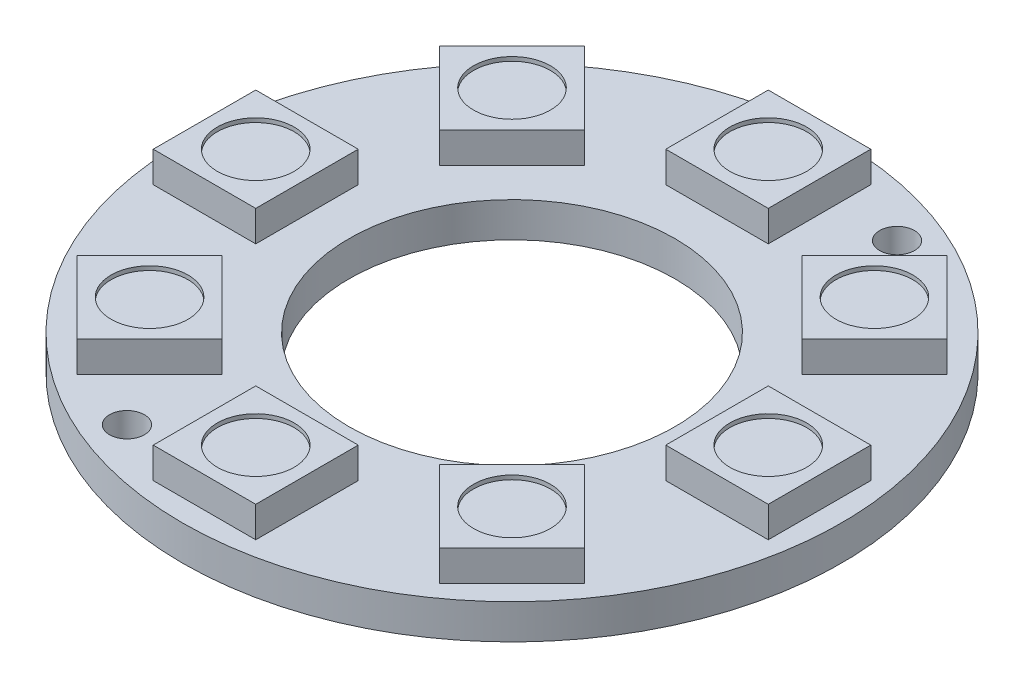
from build123d import *

# Parameters (mm, degrees)
ESQUISSE1_R                  = 16.075
ESQUISSE1_R_2                = 7.95
ESQUISSE1_R_3                = 0.85
BOSS_EXTRU_1_DEPTH           = 1.7
ESQUISSE3_W                  = 3
ESQUISSE3_H                  = 2
BOSS_EXTRU_2_DEPTH           = 0.1
ESQUISSE4_W                  = 5
ESQUISSE4_H                  = 5
BOSS_EXTRU_3_DEPTH           = 1.5
ESQUISSE5_R                  = 1.875
ENL_V_MAT_EXTRU_1_DEPTH      = 0.2
R_P_TITION_CIRCULAIRE1_COUNT = 8
ESQUISSE6_W                  = 0.108706013
ESQUISSE6_H                  = 1.211295573
BOSS_EXTRU_4_DEPTH           = 0.1


with BuildPart() as part:
    # Esquisse1 → Boss.-Extru.1 (new body)
    with BuildSketch(Plane(origin=(0, 0, 0), x_dir=(1, 0, 0), z_dir=(0, 1, 0))):
        Circle(ESQUISSE1_R)
        Circle(ESQUISSE1_R_2, mode=Mode.SUBTRACT)
        with Locations((5.50107434, 13.28076828)):
            Circle(ESQUISSE1_R_3, mode=Mode.SUBTRACT)
        with Locations((-5.50107434, -13.28076828)):
            Circle(ESQUISSE1_R_3, mode=Mode.SUBTRACT)
    extrude(amount=BOSS_EXTRU_1_DEPTH)

    # Esquisse3 → Boss.-Extru.2 (add)
    with BuildSketch(Plane.XZ):
        with Locations((-11.95, -4.5)):
            Rectangle(ESQUISSE3_W, ESQUISSE3_H)
        with Locations((-11.95, -1.5)):
            Rectangle(ESQUISSE3_W, ESQUISSE3_H)
        with Locations((-11.95, 1.5)):
            Rectangle(ESQUISSE3_W, ESQUISSE3_H)
        with Locations((-11.95, 4.5)):
            Rectangle(ESQUISSE3_W, ESQUISSE3_H)
    extrude(amount=BOSS_EXTRU_2_DEPTH)

    # Esquisse4 → Boss.-Extru.3 (add)
    with BuildSketch(Plane(origin=(0, 1.7, 0), x_dir=(1, 0, 0), z_dir=(0, 1, 0))):
        with Locations((0, 12.5)):
            Rectangle(ESQUISSE4_W, ESQUISSE4_H)
    boss_extru_3 = extrude(amount=BOSS_EXTRU_3_DEPTH)

    # Esquisse5 → Enlèv. mat.-Extru.1 (cut)
    with BuildSketch(Plane(origin=(0, 3.2, 0), x_dir=(1, 0, 0), z_dir=(0, 1, 0))):
        with Locations((0, 12.5)):
            Circle(ESQUISSE5_R)
    enl_v_mat_extru_1 = extrude(amount=-ENL_V_MAT_EXTRU_1_DEPTH, mode=Mode.SUBTRACT)

    # Répétition circulaire1: Boss.-Extru.3, Enlèv. mat.-Extru.1 ×8 about axis
    r_p_tition_circulaire1_axis = Axis((0, 1.7, 0), (0, -1, 0))
    add([boss_extru_3.rotate(r_p_tition_circulaire1_axis, i * 360 / R_P_TITION_CIRCULAIRE1_COUNT) for i in range(1, R_P_TITION_CIRCULAIRE1_COUNT)])
    add([enl_v_mat_extru_1.rotate(r_p_tition_circulaire1_axis, i * 360 / R_P_TITION_CIRCULAIRE1_COUNT) for i in range(1, R_P_TITION_CIRCULAIRE1_COUNT)], mode=Mode.SUBTRACT)

    # Esquisse6 → Boss.-Extru.4 (add)
    # profile 1 of 9: a face of its own
    with BuildSketch(Plane.XZ):
        with BuildLine():
            Line((-15.094705696, -5.1), (-15.094705696, -3.888704427))
            Line((-15.094705696, -3.888704427), (-14.850117167, -3.888704427))
            add(Edge.make_bspline(
                [(-14.850117167, -3.888704427), (-14.828843706, -3.888857594), (-14.78774349, -3.889153511), (-14.72835109, -3.89102977), (-14.673398499, -3.894348881), (-14.623066449, -3.899183517), (-14.577216761, -3.905119915), (-14.53597782, -3.912560871), (-14.499136389, -3.921347322), (-14.476478433, -3.928838475), (-14.465763764, -3.93238095)],
                knots=[0, 0, 0, 0, 1.314313732, 2.53924729, 3.670748893, 4.714932338, 5.66265055, 6.526160246, 7.303039223, 8, 8, 8, 8], degree=3))
            add(Edge.make_bspline(
                [(-14.465763764, -3.93238095), (-14.451749164, -3.937721277), (-14.42403777, -3.948280831), (-14.384581677, -3.968200172), (-14.347438038, -3.990769412), (-14.312407666, -4.016018302), (-14.280290743, -4.044661756), (-14.249832579, -4.075483028), (-14.222279161, -4.10960292), (-14.197046733, -4.146313824), (-14.174296644, -4.185183278), (-14.15452167, -4.226137219), (-14.138098581, -4.268967664), (-14.124465198, -4.313555506), (-14.113720502, -4.359998785), (-14.106389764, -4.408351582), (-14.101554622, -4.458422799), (-14.101068702, -4.492399454), (-14.100822149, -4.509638997)],
                knots=[0, 0, 0, 0, 0.984719456, 1.947108742, 2.898477687, 3.838006223, 4.779231079, 5.722358779, 6.681677486, 7.655904652, 8.64651281, 9.637519902, 10.640069247, 11.656948941, 12.698408672, 13.768548281, 14.867775369, 16, 16, 16, 16], degree=3))
            add(Edge.make_bspline(
                [(-14.100822149, -4.509638997), (-14.101039825, -4.524611039), (-14.101468778, -4.554115011), (-14.105320461, -4.597597371), (-14.110918834, -4.639789762), (-14.119586241, -4.680491266), (-14.130108078, -4.720058485), (-14.143592965, -4.758069716), (-14.159040616, -4.794873655), (-14.17705427, -4.829972666), (-14.196830014, -4.863225627), (-14.218052516, -4.894572409), (-14.240699139, -4.923565711), (-14.264985834, -4.950293332), (-14.290598754, -4.974714982), (-14.317705587, -4.997034665), (-14.346376278, -5.01681566), (-14.376482415, -5.034835277), (-14.408902266, -5.050554555), (-14.444249901, -5.063854584), (-14.482676066, -5.074876202), (-14.524086439, -5.084071976), (-14.568552573, -5.091366503), (-14.616118062, -5.096255428), (-14.666709825, -5.099561549), (-14.701449528, -5.099851012), (-14.719330245, -5.1)],
                knots=[0, 0, 0, 0, 1.105936401, 2.179363191, 3.223086493, 4.248585256, 5.251745608, 6.245858792, 7.225916811, 8.198733463, 9.158002045, 10.082870192, 10.993790845, 11.873723703, 12.748670949, 13.606408763, 14.465103618, 15.319838547, 16.196477973, 17.123216899, 18.106603292, 19.147568657, 20.255746949, 21.433717677, 22.679120308, 24, 24, 24, 24], degree=3))
            Line((-14.719330245, -5.1), (-15.094705696, -5.1))
        make_face()
        with BuildLine():
            Line((-14.985999683, -4.975764557), (-14.846962751, -4.975764557))
            add(Edge.make_bspline(
                [(-14.846962751, -4.975764557), (-14.82698386, -4.975678694), (-14.788557135, -4.97551355), (-14.733301985, -4.974064424), (-14.682815394, -4.971696536), (-14.637090194, -4.96838275), (-14.596152202, -4.963998339), (-14.559915863, -4.95910993), (-14.528499957, -4.953019726), (-14.509489734, -4.947499347), (-14.500704982, -4.944948343)],
                knots=[0, 0, 0, 0, 1.375205317, 2.645023457, 3.804390687, 4.853969522, 5.800190428, 6.637939096, 7.370582563, 8, 8, 8, 8], degree=3))
            add(Edge.make_bspline(
                [(-14.500704982, -4.944948343), (-14.489648151, -4.941054354), (-14.46779858, -4.933359383), (-14.43634605, -4.919323007), (-14.407012969, -4.902696394), (-14.379288135, -4.884214697), (-14.353564835, -4.863226059), (-14.329538228, -4.840186875), (-14.307256688, -4.814979892), (-14.286950422, -4.787636396), (-14.268778115, -4.758326575), (-14.253041229, -4.727338577), (-14.239249234, -4.695011932), (-14.2284242, -4.660850227), (-14.219939737, -4.625158864), (-14.213930089, -4.587935331), (-14.210187281, -4.54918658), (-14.209750713, -4.522831514), (-14.209528162, -4.509396349)],
                knots=[0, 0, 0, 0, 0.998632004, 1.973411704, 2.929992603, 3.868527914, 4.809262121, 5.754881198, 6.702106254, 7.672490631, 8.653608572, 9.636854334, 10.631411391, 11.644891563, 12.686317036, 13.754757253, 14.855430412, 16, 16, 16, 16], degree=3))
            add(Edge.make_bspline(
                [(-14.209528162, -4.509396349), (-14.209705803, -4.495229908), (-14.210054779, -4.46739981), (-14.214441161, -4.426565065), (-14.220851183, -4.387291176), (-14.230120601, -4.349575518), (-14.241932767, -4.313344507), (-14.25667411, -4.278798527), (-14.27351687, -4.245572734), (-14.293556315, -4.214434006), (-14.315503466, -4.184984604), (-14.339860155, -4.15800562), (-14.366239417, -4.133435596), (-14.394353536, -4.110891893), (-14.424994849, -4.091281476), (-14.457441543, -4.073739604), (-14.49216962, -4.058852473), (-14.516330708, -4.050934454), (-14.528609427, -4.0469105)],
                knots=[0, 0, 0, 0, 1.122418816, 2.205001699, 3.251619955, 4.274784885, 5.280384055, 6.268708349, 7.249350384, 8.229342522, 9.199999885, 10.157847722, 11.105861043, 12.055065948, 13.010012805, 13.98527497, 14.976112212, 16, 16, 16, 16], degree=3))
            add(Edge.make_bspline(
                [(-14.528609427, -4.0469105), (-14.538767403, -4.04410153), (-14.560366045, -4.03812889), (-14.5956111, -4.031613722), (-14.635277621, -4.025867163), (-14.679541719, -4.021001894), (-14.728352936, -4.017510829), (-14.781748814, -4.014890515), (-14.83975243, -4.013123188), (-14.879961399, -4.013002506), (-14.900830463, -4.01293987)],
                knots=[0, 0, 0, 0, 0.674548936, 1.434276114, 2.292660221, 3.240891867, 4.284742987, 5.42552168, 6.663806718, 8, 8, 8, 8], degree=3))
            Line((-14.900830463, -4.01293987), (-14.985999683, -4.01293987))
            Line((-14.985999683, -4.01293987), (-14.985999683, -4.975764557))
        make_face(mode=Mode.SUBTRACT)
    # profile 2 of 9: a face of its own
    with BuildSketch(Plane.XZ):
        with Locations((-13.797998256, -4.494352214)):
            Rectangle(ESQUISSE6_W, ESQUISSE6_H)
    # profile 3 of 9: a face of its own
    with BuildSketch(Plane.XZ):
        Polygon((-14.413354701, -1.041666667), (-14.31159188, -1.041666667), (-13.958814103, -1.875697783), (-13.606036325, -1.041666667), (-13.504273504, -1.041666667), (-13.952029915, -2.1), (-13.965598291, -2.1), align=None)
    # profile 4 of 9: a face of its own
    with BuildSketch(Plane.XZ):
        with BuildLine():
            Line((-14.576175214, -1.041666667), (-14.576175214, -1.150213675))
            Line((-14.576175214, -1.150213675), (-14.936161191, -1.150213675))
            Line((-14.936161191, -1.150213675), (-14.993190772, -1.42857739))
            add(Edge.make_bspline(
                [(-14.993190772, -1.42857739), (-14.981985781, -1.425483951), (-14.960277884, -1.419490902), (-14.928237641, -1.412836776), (-14.897820474, -1.408825558), (-14.878082446, -1.408277852), (-14.868531317, -1.408012821)],
                knots=[0, 0, 0, 0, 1.100273476, 2.13160584, 3.095893838, 4, 4, 4, 4], degree=3))
            add(Edge.make_bspline(
                [(-14.868531317, -1.408012821), (-14.856713138, -1.408268615), (-14.833475647, -1.408771572), (-14.799476251, -1.413601155), (-14.767020828, -1.421202986), (-14.736177255, -1.431822763), (-14.706888469, -1.445402611), (-14.679423944, -1.462366164), (-14.653371433, -1.482182195), (-14.629198315, -1.504965092), (-14.607268346, -1.530039009), (-14.587986725, -1.556998651), (-14.571608989, -1.585582016), (-14.558437047, -1.6160622), (-14.547918927, -1.64810223), (-14.540918204, -1.682039225), (-14.536256485, -1.717553299), (-14.535735668, -1.741835872), (-14.535470085, -1.754218416)],
                knots=[0, 0, 0, 0, 1.052922333, 2.070308379, 3.05430497, 4.020497103, 4.973039431, 5.925935799, 6.892292201, 7.88610001, 8.88166317, 9.857072816, 10.836096531, 11.812156883, 12.81219415, 13.836441305, 14.89672472, 16, 16, 16, 16], degree=3))
            add(Edge.make_bspline(
                [(-14.535470085, -1.754218416), (-14.535671192, -1.762842992), (-14.536070686, -1.779975591), (-14.538102259, -1.805419194), (-14.542013773, -1.830324146), (-14.547265442, -1.854693751), (-14.55408184, -1.87848187), (-14.56233353, -1.901756594), (-14.572431853, -1.924373059), (-14.583508483, -1.946545261), (-14.595980632, -1.967771953), (-14.609823181, -1.987622956), (-14.624447984, -2.00639606), (-14.640184308, -2.023889927), (-14.657178418, -2.039989601), (-14.675224503, -2.054790629), (-14.694178564, -2.068543317), (-14.714333839, -2.080689414), (-14.735241209, -2.091866308), (-14.757202599, -2.101035568), (-14.779718096, -2.109233276), (-14.803111761, -2.115767585), (-14.827330604, -2.120887667), (-14.852414548, -2.12436523), (-14.878232036, -2.126898105), (-14.895732338, -2.127056661), (-14.904572316, -2.127136752)],
                knots=[0, 0, 0, 0, 1.056347294, 2.098418968, 3.122841568, 4.141288669, 5.149314143, 6.15115421, 7.162517403, 8.180376062, 9.185164535, 10.17417709, 11.141909838, 12.097768115, 13.052685741, 14.0056014, 14.954263652, 15.917497458, 16.885230207, 17.854509472, 18.828990115, 19.81800267, 20.826176721, 21.857883937, 22.917946725, 24, 24, 24, 24], degree=3))
            add(Edge.make_bspline(
                [(-14.904572316, -2.127136752), (-14.915117604, -2.126927856), (-14.935864212, -2.126516877), (-14.966259717, -2.122217478), (-14.995504371, -2.116059818), (-15.023362759, -2.106795993), (-15.050084546, -2.095188406), (-15.075309987, -2.08051804), (-15.099683638, -2.063893407), (-15.122214659, -2.044274824), (-15.14312615, -2.022831272), (-15.161845499, -1.999560747), (-15.178516843, -1.974847321), (-15.192873209, -1.948570974), (-15.205119039, -1.920800752), (-15.214739286, -1.891432606), (-15.222503931, -1.860619986), (-15.225788823, -1.839406901), (-15.227457265, -1.828632479)],
                knots=[0, 0, 0, 0, 1.0467383, 2.05933395, 3.04377827, 4.011590433, 4.970194871, 5.932262533, 6.905835911, 7.896367577, 8.894135286, 9.877477877, 10.858688626, 11.851381753, 12.8477658, 13.868841284, 14.917554742, 16, 16, 16, 16], degree=3))
            Line((-15.227457265, -1.828632479), (-15.132478632, -1.828632479))
            add(Edge.make_bspline(
                [(-15.132478632, -1.828632479), (-15.130141664, -1.838724882), (-15.125649881, -1.858123042), (-15.115790523, -1.885377043), (-15.103735842, -1.909664046), (-15.08940167, -1.931305325), (-15.072302018, -1.950176617), (-15.052789548, -1.966994157), (-15.030912974, -1.982166161), (-15.006603593, -1.994812569), (-14.980957733, -2.00559812), (-14.95411622, -2.01278018), (-14.926809905, -2.017830212), (-14.90834097, -2.018335721), (-14.899060163, -2.018589744)],
                knots=[0, 0, 0, 0, 1.136247022, 2.183929868, 3.172523383, 4.106158343, 5.02341133, 5.958108904, 6.928429099, 7.938127109, 8.96079061, 9.975095812, 10.982467395, 12, 12, 12, 12], degree=3))
            add(Edge.make_bspline(
                [(-14.899060163, -2.018589744), (-14.8900013, -2.018341556), (-14.872164325, -2.017852873), (-14.845914215, -2.014091552), (-14.820570798, -2.008298668), (-14.796384145, -1.99962945), (-14.772931013, -1.98909307), (-14.750804658, -1.975572083), (-14.729364979, -1.960011554), (-14.709278377, -1.942184192), (-14.690881686, -1.922538594), (-14.674626859, -1.901529953), (-14.661087173, -1.879118431), (-14.649677097, -1.855692025), (-14.641012886, -1.830993985), (-14.634831922, -1.805140058), (-14.631202426, -1.778066386), (-14.630703141, -1.75960019), (-14.630448718, -1.750190304)],
                knots=[0, 0, 0, 0, 1.027316725, 2.022795036, 3.002884548, 3.971462791, 4.93288096, 5.914575861, 6.907176829, 7.935150275, 8.956128384, 9.956726525, 10.942570165, 11.921478529, 12.907843606, 13.90538589, 14.932640048, 16, 16, 16, 16], degree=3))
            add(Edge.make_bspline(
                [(-14.630448718, -1.750190304), (-14.63064783, -1.741700732), (-14.631037562, -1.725083602), (-14.634221806, -1.700772413), (-14.63976051, -1.677769374), (-14.647448207, -1.655963403), (-14.657208915, -1.635333934), (-14.669136729, -1.615859675), (-14.683455494, -1.597797302), (-14.699811851, -1.581138363), (-14.717730354, -1.565763841), (-14.737519295, -1.552657415), (-14.758764559, -1.541631421), (-14.781210176, -1.532116098), (-14.805390038, -1.525282063), (-14.830825305, -1.520151297), (-14.857790643, -1.517183319), (-14.876227018, -1.51677151), (-14.885703793, -1.516559829)],
                knots=[0, 0, 0, 0, 1.045622112, 2.046656509, 3.013763289, 3.955457236, 4.890082067, 5.820317437, 6.762574623, 7.722996705, 8.69280354, 9.665887285, 10.63943826, 11.638615906, 12.663482002, 13.728887084, 14.832589034, 16, 16, 16, 16], degree=3))
            add(Edge.make_bspline(
                [(-14.885703793, -1.516559829), (-14.893907064, -1.516735389), (-14.910844738, -1.517097875), (-14.936826164, -1.51976684), (-14.964128662, -1.524072531), (-14.992647569, -1.529995039), (-15.022468532, -1.537745389), (-15.05352862, -1.547032868), (-15.085893138, -1.558136901), (-15.107700164, -1.566522595), (-15.118910256, -1.570833333)],
                knots=[0, 0, 0, 0, 0.817624296, 1.688186739, 2.600797293, 3.572016777, 4.590301741, 5.671205678, 6.80286297, 8, 8, 8, 8], degree=3))
            Line((-15.118910256, -1.570833333), (-15.010363248, -1.041666667))
            Line((-15.010363248, -1.041666667), (-14.576175214, -1.041666667))
        make_face()
    # profile 5 of 9: a face of its own
    with BuildSketch(Plane.XZ):
        with BuildLine():
            Line((-14.162339744, 0.9), (-14.162339744, 1.69375))
            Line((-14.162339744, 1.69375), (-14.002063301, 1.69375))
            add(Edge.make_bspline(
                [(-14.002063301, 1.69375), (-13.988123013, 1.693649631), (-13.961190448, 1.69345572), (-13.922271197, 1.692226226), (-13.886261308, 1.690051245), (-13.853279213, 1.686883156), (-13.823234367, 1.682993093), (-13.796210897, 1.678117109), (-13.772069071, 1.672359434), (-13.757221538, 1.667450555), (-13.750200321, 1.665129207)],
                knots=[0, 0, 0, 0, 1.314313732, 2.53924729, 3.670748893, 4.714932338, 5.66265055, 6.526160246, 7.303039223, 8, 8, 8, 8], degree=3))
            add(Edge.make_bspline(
                [(-13.750200321, 1.665129207), (-13.741016692, 1.661629743), (-13.72285769, 1.654710172), (-13.697002503, 1.641657225), (-13.672662644, 1.626867825), (-13.649707588, 1.610322478), (-13.628661686, 1.591552706), (-13.608702752, 1.571355831), (-13.59064727, 1.548997404), (-13.57411271, 1.524941112), (-13.559204802, 1.499470343), (-13.546246457, 1.472633631), (-13.535484569, 1.444567264), (-13.526550748, 1.415349293), (-13.519509855, 1.384915472), (-13.514706096, 1.353230363), (-13.511537675, 1.32041919), (-13.511219256, 1.298154624), (-13.511057692, 1.286857722)],
                knots=[0, 0, 0, 0, 0.984719456, 1.947108742, 2.898477687, 3.838006223, 4.779231079, 5.722358779, 6.681677486, 7.655904652, 8.64651281, 9.637519902, 10.640069247, 11.656948941, 12.698408672, 13.768548281, 14.867775369, 16, 16, 16, 16], degree=3))
            add(Edge.make_bspline(
                [(-13.511057692, 1.286857722), (-13.511200333, 1.277046691), (-13.511481422, 1.25771303), (-13.514005392, 1.22921947), (-13.51767395, 1.201571214), (-13.523353616, 1.174899921), (-13.530248472, 1.148971915), (-13.539084985, 1.124063531), (-13.549207678, 1.099946274), (-13.561011847, 1.076946239), (-13.573970696, 1.055155903), (-13.587877592, 1.034614667), (-13.602717699, 1.015615644), (-13.618632531, 0.998101298), (-13.635416423, 0.982098032), (-13.653179263, 0.967472165), (-13.671966883, 0.954509875), (-13.691695136, 0.942701798), (-13.712939544, 0.93240111), (-13.736102499, 0.923685733), (-13.761282785, 0.916463376), (-13.788418593, 0.910437476), (-13.81755681, 0.905657445), (-13.848726004, 0.902453781), (-13.881878286, 0.900287312), (-13.904642869, 0.90009763), (-13.916359926, 0.9)],
                knots=[0, 0, 0, 0, 1.105936401, 2.179363191, 3.223086493, 4.248585256, 5.251745608, 6.245858792, 7.225916811, 8.198733463, 9.158002045, 10.082870192, 10.993790845, 11.873723703, 12.748670949, 13.606408763, 14.465103618, 15.319838547, 16.196477973, 17.123216899, 18.106603292, 19.147568657, 20.255746949, 21.433717677, 22.679120308, 24, 24, 24, 24], degree=3))
            Line((-13.916359926, 0.9), (-14.162339744, 0.9))
        make_face()
        with BuildLine():
            Line((-14.091105769, 0.981410256), (-13.999996244, 0.981410256))
            add(Edge.make_bspline(
                [(-13.999996244, 0.981410256), (-13.986904274, 0.981466521), (-13.961723622, 0.981574739), (-13.925515469, 0.982524337), (-13.892432106, 0.98407599), (-13.862468835, 0.986247481), (-13.835642574, 0.989120542), (-13.811897259, 0.992323868), (-13.791310727, 0.996314719), (-13.778853516, 0.999932168), (-13.773096955, 1.001603816)],
                knots=[0, 0, 0, 0, 1.375205317, 2.645023457, 3.804390687, 4.853969522, 5.800190428, 6.637939096, 7.370582563, 8, 8, 8, 8], degree=3))
            add(Edge.make_bspline(
                [(-13.773096955, 1.001603816), (-13.765851523, 1.004155509), (-13.751533716, 1.009197947), (-13.730923184, 1.018395845), (-13.711701506, 1.0292911), (-13.693533697, 1.041401973), (-13.676677473, 1.05515562), (-13.660933075, 1.070252969), (-13.646332203, 1.086770856), (-13.633025708, 1.104688778), (-13.621117574, 1.123895214), (-13.610805349, 1.144201342), (-13.601767591, 1.165384672), (-13.594674053, 1.187770499), (-13.589114269, 1.211158697), (-13.585176206, 1.235550909), (-13.582723581, 1.260942582), (-13.582437502, 1.278212796), (-13.582291667, 1.287016727)],
                knots=[0, 0, 0, 0, 0.998632004, 1.973411704, 2.929992603, 3.868527914, 4.809262121, 5.754881198, 6.702106254, 7.672490631, 8.653608572, 9.636854334, 10.631411391, 11.644891563, 12.686317036, 13.754757253, 14.855430412, 16, 16, 16, 16], degree=3))
            add(Edge.make_bspline(
                [(-13.582291667, 1.287016727), (-13.582408073, 1.296299855), (-13.582636754, 1.314536644), (-13.585511107, 1.341295248), (-13.589711531, 1.367031038), (-13.595785688, 1.391745736), (-13.603526084, 1.415487559), (-13.61318594, 1.438125198), (-13.624222834, 1.45989773), (-13.637354484, 1.480302631), (-13.651736234, 1.499600533), (-13.667696932, 1.517279594), (-13.684983001, 1.533380087), (-13.703405905, 1.548152753), (-13.723484854, 1.561003265), (-13.744746852, 1.57249828), (-13.767503817, 1.58225367), (-13.783336339, 1.587442269), (-13.791382462, 1.590079127)],
                knots=[0, 0, 0, 0, 1.122418816, 2.205001699, 3.251619955, 4.274784885, 5.280384055, 6.268708349, 7.249350384, 8.229342522, 9.199999885, 10.157847722, 11.105861043, 12.055065948, 13.010012805, 13.98527497, 14.976112212, 16, 16, 16, 16], degree=3))
            add(Edge.make_bspline(
                [(-13.791382462, 1.590079127), (-13.798038883, 1.591919816), (-13.812192259, 1.595833628), (-13.835287995, 1.600102954), (-13.861281073, 1.603868617), (-13.890286899, 1.607056779), (-13.922272406, 1.60934444), (-13.957262196, 1.611061506), (-13.995271392, 1.612219617), (-14.021619931, 1.612298699), (-14.035295222, 1.612339744)],
                knots=[0, 0, 0, 0, 0.674548936, 1.434276114, 2.292660221, 3.240891867, 4.284742987, 5.42552168, 6.663806718, 8, 8, 8, 8], degree=3))
            Line((-14.035295222, 1.612339744), (-14.091105769, 1.612339744))
            Line((-14.091105769, 1.612339744), (-14.091105769, 0.981410256))
        make_face(mode=Mode.SUBTRACT)
    # profile 6 of 9: a face of its own
    with BuildSketch(Plane.XZ):
        Polygon((-14.976442308, 0.9), (-14.976442308, 1.69375), (-14.961495893, 1.69375), (-14.437099359, 1.069021685), (-14.437099359, 1.69375), (-14.365865385, 1.69375), (-14.365865385, 0.9), (-14.382083834, 0.9), (-14.905208333, 1.523297276), (-14.905208333, 0.9), align=None)
    # profile 7 of 9: a face of its own
    with BuildSketch(Plane.XZ):
        with BuildLine():
            Line((-15.190144231, 1.558278245), (-15.251201923, 1.500400641))
            add(Edge.make_bspline(
                [(-15.251201923, 1.500400641), (-15.262250671, 1.510794426), (-15.284084703, 1.53133415), (-15.319681044, 1.557983965), (-15.356820296, 1.580813599), (-15.395308666, 1.599388763), (-15.434193017, 1.614209836), (-15.472957221, 1.624761753), (-15.511203657, 1.631491061), (-15.53664158, 1.63229578), (-15.549176182, 1.632692308)],
                knots=[0, 0, 0, 0, 1.08915593, 2.152340314, 3.188132944, 4.216796309, 5.218260357, 6.173443236, 7.099959455, 8, 8, 8, 8], degree=3))
            add(Edge.make_bspline(
                [(-15.549176182, 1.632692308), (-15.556867551, 1.632598508), (-15.572230342, 1.632411151), (-15.595049962, 1.630019874), (-15.617630253, 1.626580699), (-15.639928589, 1.621604595), (-15.661988328, 1.615297897), (-15.683732744, 1.607409051), (-15.705202401, 1.598211701), (-15.726195066, 1.587583962), (-15.74654693, 1.575909068), (-15.76576857, 1.562971274), (-15.783982502, 1.549185245), (-15.800846384, 1.534205826), (-15.816457221, 1.518168705), (-15.831186584, 1.501372205), (-15.844516435, 1.483357432), (-15.856556752, 1.464455835), (-15.867297691, 1.444999392), (-15.876779296, 1.425175375), (-15.884738814, 1.405049537), (-15.89103653, 1.384596622), (-15.896232339, 1.363974864), (-15.899887582, 1.343041472), (-15.901948321, 1.321774032), (-15.902304778, 1.307532511), (-15.902483974, 1.300373097)],
                knots=[0, 0, 0, 0, 1.02818874, 2.053710826, 3.065248034, 4.081641283, 5.106893873, 6.131558223, 7.173050175, 8.228653731, 9.27666206, 10.308777013, 11.325269123, 12.329503258, 13.32196095, 14.316845687, 15.314881793, 16.315733098, 17.311955233, 18.285320748, 19.252783886, 20.203351036, 21.145449891, 22.095197417, 23.042428769, 24, 24, 24, 24], degree=3))
            add(Edge.make_bspline(
                [(-15.902483974, 1.300373097), (-15.902312588, 1.293054537), (-15.901970284, 1.278437401), (-15.899779462, 1.256621959), (-15.895713593, 1.23513052), (-15.890278059, 1.213892461), (-15.883478838, 1.19287141), (-15.875003251, 1.172158501), (-15.864964445, 1.151754502), (-15.853344727, 1.131843257), (-15.840602499, 1.112447857), (-15.826327908, 1.094178108), (-15.811164882, 1.076790725), (-15.794561016, 1.060671757), (-15.777048727, 1.045390052), (-15.7581048, 1.031366639), (-15.738101742, 1.018331399), (-15.717009035, 1.006448617), (-15.695055547, 0.99583311), (-15.672545533, 0.986393405), (-15.649407082, 0.978619341), (-15.625761794, 0.972283378), (-15.601637855, 0.967089917), (-15.576912814, 0.963748801), (-15.551768468, 0.961324274), (-15.534818814, 0.961147002), (-15.526279547, 0.961057692)],
                knots=[0, 0, 0, 0, 0.93586088, 1.869166235, 2.799637598, 3.729985548, 4.670839027, 5.622275134, 6.589130586, 7.576015415, 8.568469353, 9.55398029, 10.53834874, 11.515998671, 12.510579167, 13.508179873, 14.527009472, 15.561807829, 16.601455013, 17.643573243, 18.680854198, 19.719860599, 20.772568776, 21.833555941, 22.908541556, 24, 24, 24, 24], degree=3))
            add(Edge.make_bspline(
                [(-15.526279547, 0.961057692), (-15.515988386, 0.961272816), (-15.49578002, 0.961695246), (-15.466074166, 0.964983704), (-15.437543827, 0.970119674), (-15.41026917, 0.977641225), (-15.384218517, 0.987235094), (-15.359296368, 0.99880012), (-15.335698938, 1.012779885), (-15.31335529, 1.028558244), (-15.292772857, 1.046137501), (-15.274209511, 1.065106868), (-15.257961337, 1.085374269), (-15.243786164, 1.106820331), (-15.23205938, 1.12962257), (-15.222433961, 1.153669241), (-15.215055875, 1.178971159), (-15.212027157, 1.196454439), (-15.210496795, 1.205288462)],
                knots=[0, 0, 0, 0, 1.13008108, 2.219097802, 3.278683437, 4.311054135, 5.322181354, 6.324827112, 7.324222904, 8.330512327, 9.32562643, 10.293043162, 11.24128371, 12.174520618, 13.111833804, 14.052305215, 15.015860969, 16, 16, 16, 16], degree=3))
            Line((-15.210496795, 1.205288462), (-15.475080128, 1.205288462))
            Line((-15.475080128, 1.205288462), (-15.475080128, 1.286698718))
            Line((-15.475080128, 1.286698718), (-15.139262821, 1.286698718))
            add(Edge.make_bspline(
                [(-15.139262821, 1.286698718), (-15.139649683, 1.271525055), (-15.140406841, 1.241827457), (-15.145717917, 1.198518127), (-15.154294162, 1.157612404), (-15.166009982, 1.119067207), (-15.181176341, 1.08293716), (-15.199630468, 1.04918558), (-15.221667717, 1.018030511), (-15.24650312, 0.989217612), (-15.274375075, 0.963516166), (-15.304530458, 0.940926962), (-15.337019092, 0.921899048), (-15.371810245, 0.906418505), (-15.408790022, 0.894336724), (-15.448043994, 0.88577067), (-15.489518928, 0.880638517), (-15.517943496, 0.879982794), (-15.532480719, 0.879647436)],
                knots=[0, 0, 0, 0, 1.140356446, 2.231883559, 3.274166699, 4.278491846, 5.25512956, 6.21435461, 7.1637429, 8.11826594, 9.068280886, 10.0076534, 10.945064095, 11.891975133, 12.864533718, 13.863980011, 14.907571808, 16, 16, 16, 16], degree=3))
            add(Edge.make_bspline(
                [(-15.532480719, 0.879647436), (-15.541441053, 0.879776504), (-15.55911372, 0.880031069), (-15.585214699, 0.881840218), (-15.610596016, 0.884625277), (-15.635253975, 0.888831046), (-15.659279278, 0.893982405), (-15.682551934, 0.900578857), (-15.705160597, 0.908214437), (-15.727140211, 0.916899349), (-15.748291278, 0.926962207), (-15.768708006, 0.938144929), (-15.788503253, 0.950389852), (-15.807542178, 0.96390874), (-15.825923981, 0.978600476), (-15.843530137, 0.994494508), (-15.860459209, 1.011542244), (-15.871063814, 1.023647841), (-15.876407252, 1.029747596)],
                knots=[0, 0, 0, 0, 1.107784379, 2.184907829, 3.233506516, 4.263428166, 5.276301166, 6.270063455, 7.25232949, 8.225834625, 9.190232166, 10.146266622, 11.1027726, 12.066435141, 13.031522626, 14.010570082, 14.99756817, 16, 16, 16, 16], degree=3))
            add(Edge.make_bspline(
                [(-15.876407252, 1.029747596), (-15.884160133, 1.039424691), (-15.899537205, 1.05861825), (-15.919330644, 1.08937038), (-15.936203819, 1.121211516), (-15.949894379, 1.154230298), (-15.960584623, 1.188395841), (-15.968251399, 1.223664487), (-15.972743409, 1.260081654), (-15.97339055, 1.284725383), (-15.973717949, 1.297193009)],
                knots=[0, 0, 0, 0, 1.023165419, 2.029347347, 3.013907458, 3.994755782, 4.975994455, 5.96558838, 6.970761222, 8, 8, 8, 8], degree=3))
            add(Edge.make_bspline(
                [(-15.973717949, 1.297193009), (-15.973597245, 1.306528927), (-15.973357371, 1.325082109), (-15.970448727, 1.352626891), (-15.966275548, 1.379682584), (-15.960141663, 1.406227071), (-15.952409117, 1.43227808), (-15.942758594, 1.457847708), (-15.93152252, 1.482951043), (-15.918462952, 1.507415295), (-15.903929512, 1.530915831), (-15.888156515, 1.553358048), (-15.870919985, 1.574333246), (-15.852501401, 1.594107066), (-15.832681013, 1.612431091), (-15.8116445, 1.629474969), (-15.789375653, 1.645261565), (-15.765804412, 1.659542224), (-15.741282598, 1.672370045), (-15.715868991, 1.68361617), (-15.689571348, 1.6929106), (-15.662586687, 1.700796797), (-15.634710754, 1.706628623), (-15.606145838, 1.710857892), (-15.576743045, 1.713751814), (-15.556868445, 1.713984554), (-15.546791116, 1.714102564)],
                knots=[0, 0, 0, 0, 1.008945113, 2.00506715, 2.99143336, 3.967273523, 4.948097931, 5.927297278, 6.919902385, 7.919676788, 8.923139349, 9.905703106, 10.883022732, 11.856032218, 12.825136022, 13.798837087, 14.781400844, 15.773989409, 16.776158564, 17.77167057, 18.775803737, 19.789618931, 20.80898985, 21.851988756, 22.910860228, 24, 24, 24, 24], degree=3))
            add(Edge.make_bspline(
                [(-15.546791116, 1.714102564), (-15.5385728, 1.713971144), (-15.522276845, 1.713710552), (-15.498027616, 1.711904284), (-15.474153201, 1.709041368), (-15.450618198, 1.705134579), (-15.427502754, 1.699813349), (-15.404741019, 1.693445595), (-15.382299998, 1.686031557), (-15.36025002, 1.677189444), (-15.338442823, 1.667153354), (-15.316757156, 1.655856381), (-15.295267113, 1.643105353), (-15.273935426, 1.628862409), (-15.252627579, 1.613372169), (-15.231680598, 1.596191604), (-15.210588859, 1.577998229), (-15.197026662, 1.564916734), (-15.190144231, 1.558278245)],
                knots=[0, 0, 0, 0, 0.985871117, 1.954866573, 2.915460327, 3.869826059, 4.81536089, 5.759505086, 6.70452669, 7.649098992, 8.607881297, 9.583363685, 10.581137262, 11.603961102, 12.659522466, 13.73993555, 14.853081303, 16, 16, 16, 16], degree=3))
        make_face()
    # profile 8 of 9: a face of its own
    with BuildSketch(Plane.XZ):
        with BuildLine():
            add(Edge.make_bspline(
                [(-14.030048077, 4.296556991), (-14.029973687, 4.309279077), (-14.029829184, 4.333991913), (-14.028221631, 4.370002002), (-14.025551152, 4.403784067), (-14.021891426, 4.435339727), (-14.017437813, 4.464677127), (-14.011492515, 4.491717866), (-14.004731397, 4.516587099), (-13.996895396, 4.53936592), (-13.988053522, 4.560361221), (-13.978430038, 4.579961222), (-13.967643022, 4.598136267), (-13.956308973, 4.615176445), (-13.943969092, 4.630802818), (-13.930974545, 4.645236065), (-13.916818155, 4.65814261), (-13.901981151, 4.669900611), (-13.886329203, 4.680207902), (-13.870308456, 4.689286755), (-13.853808637, 4.697042796), (-13.836784699, 4.703141163), (-13.819389655, 4.708178266), (-13.801562695, 4.711622902), (-13.783274386, 4.713790272), (-13.770930114, 4.713997479), (-13.764669722, 4.714102564)],
                knots=[0, 0, 0, 0, 1.646270934, 3.197905019, 4.663502075, 6.030701355, 7.308322542, 8.50163776, 9.611534131, 10.641858119, 11.616356847, 12.558055219, 13.465016945, 14.349605745, 15.204443733, 16.039544428, 16.859896111, 17.680448484, 18.487036065, 19.28249412, 20.06191084, 20.843045899, 21.620316918, 22.403196591, 23.190181807, 24, 24, 24, 24], degree=3))
            add(Edge.make_bspline(
                [(-13.764669722, 4.714102564), (-13.758357033, 4.713991935), (-13.745803081, 4.713771927), (-13.727242853, 4.71165739), (-13.709111407, 4.708148761), (-13.691486043, 4.703177397), (-13.674221984, 4.697009806), (-13.657454263, 4.689279335), (-13.641078728, 4.680280734), (-13.62535561, 4.669707105), (-13.610112295, 4.657918267), (-13.595723203, 4.644591734), (-13.582187025, 4.629862065), (-13.569333875, 4.613886857), (-13.55752841, 4.596359703), (-13.546285863, 4.57758545), (-13.53622292, 4.557235772), (-13.526531306, 4.535650201), (-13.518165864, 4.512231479), (-13.510621555, 4.487111613), (-13.504525789, 4.459993896), (-13.499448222, 4.431020605), (-13.495514647, 4.400085336), (-13.492649744, 4.367254404), (-13.491136384, 4.332506208), (-13.490851382, 4.308748625), (-13.490705128, 4.296556991)],
                knots=[0, 0, 0, 0, 0.810914788, 1.612654377, 2.396697861, 3.181598691, 3.963628158, 4.749916497, 5.551656086, 6.361998678, 7.18212741, 8.025565596, 8.878627764, 9.750805457, 10.657531673, 11.591944965, 12.560506719, 13.57287815, 14.630710178, 15.753379473, 16.941251878, 18.199788006, 19.531962791, 20.947069417, 22.433333509, 24, 24, 24, 24], degree=3))
            add(Edge.make_bspline(
                [(-13.490705128, 4.296556991), (-13.490852898, 4.284418533), (-13.491140822, 4.260767244), (-13.492632779, 4.226175398), (-13.495571611, 4.193518698), (-13.499247805, 4.162718826), (-13.504339363, 4.133903973), (-13.51059982, 4.106974428), (-13.517550876, 4.081813898), (-13.526131266, 4.058628503), (-13.535522624, 4.037094809), (-13.545740499, 4.016986366), (-13.556687406, 3.998125439), (-13.568613782, 3.980662996), (-13.581325895, 3.964475337), (-13.595095822, 3.949848197), (-13.609535401, 3.936429134), (-13.624823574, 3.924488497), (-13.640791908, 3.914037122), (-13.657111199, 3.904690409), (-13.674071002, 3.897153709), (-13.691286975, 3.890682369), (-13.709005372, 3.885738338), (-13.727204107, 3.882319803), (-13.745790611, 3.879922259), (-13.758354894, 3.879739361), (-13.764669722, 3.879647436)],
                knots=[0, 0, 0, 0, 1.561518951, 3.042555995, 4.452378317, 5.7783523, 7.031515105, 8.214008947, 9.334062868, 10.386615937, 11.391082383, 12.354592575, 13.286541444, 14.194233754, 15.072674879, 15.931287219, 16.775624067, 17.606195743, 18.42308326, 19.229000347, 20.022332153, 20.807536673, 21.593273796, 22.3848459, 23.188221202, 24, 24, 24, 24], degree=3))
            add(Edge.make_bspline(
                [(-13.764669722, 3.879647436), (-13.77092994, 3.879753199), (-13.78327387, 3.879961742), (-13.801564688, 3.882119321), (-13.819318027, 3.885588122), (-13.836621495, 3.890445102), (-13.853563865, 3.896390252), (-13.869914273, 3.90413582), (-13.885854516, 3.913056225), (-13.901342065, 3.923215187), (-13.916085894, 3.934854211), (-13.930168971, 3.947727541), (-13.943237502, 3.962156422), (-13.955400949, 3.977913022), (-13.966961144, 3.994852382), (-13.977594984, 4.013205781), (-13.987430874, 4.032900445), (-13.996421451, 4.054063614), (-14.004392666, 4.077004106), (-14.011433843, 4.101984366), (-14.016993303, 4.129224877), (-14.021751938, 4.158506851), (-14.025590146, 4.189956117), (-14.028210502, 4.223589749), (-14.02983005, 4.259386788), (-14.029974075, 4.283940826), (-14.030048077, 4.296556991)],
                knots=[0, 0, 0, 0, 0.810891512, 1.598919785, 2.382837074, 3.152667961, 3.926044502, 4.706494248, 5.493654104, 6.291793342, 7.103789334, 7.925228297, 8.761435821, 9.622817696, 10.50288917, 11.416980706, 12.369136599, 13.353924996, 14.394355917, 15.514179734, 16.714354668, 17.994756427, 19.357759367, 20.818452758, 22.365282078, 24, 24, 24, 24], degree=3))
        make_face()
        with BuildLine():
            add(Edge.make_bspline(
                [(-13.958814103, 4.296875), (-13.958787014, 4.286273063), (-13.958734439, 4.265696785), (-13.95736098, 4.235796617), (-13.955489945, 4.207908703), (-13.953076651, 4.181997633), (-13.949492768, 4.158151112), (-13.945477121, 4.136205131), (-13.940590322, 4.116275829), (-13.934808417, 4.09822645), (-13.928222764, 4.081750679), (-13.921032327, 4.066419689), (-13.913307842, 4.052052375), (-13.904662963, 4.038777789), (-13.89524794, 4.026552641), (-13.885275433, 4.015160552), (-13.874373257, 4.005001237), (-13.859291159, 3.992816754), (-13.839380173, 3.980225807), (-13.814293034, 3.969261605), (-13.788514653, 3.962371298), (-13.771017851, 3.961495053), (-13.762284655, 3.961057692)],
                knots=[0, 0, 0, 0, 1.459021318, 2.831673884, 4.118529203, 5.306027144, 6.411944654, 7.436330062, 8.375795394, 9.233974572, 10.042671642, 10.816086306, 11.563610507, 12.285937304, 12.993564865, 13.685989202, 14.367179055, 15.041617293, 16.353048772, 17.594441528, 18.799311195, 20, 20, 20, 20], degree=3))
            add(Edge.make_bspline(
                [(-13.762284655, 3.961057692), (-13.753494969, 3.961420046), (-13.735933744, 3.962144006), (-13.710276616, 3.969128719), (-13.685368679, 3.979667347), (-13.665848793, 3.992128656), (-13.650998287, 4.003995974), (-13.640358184, 4.014113939), (-13.630592327, 4.025443216), (-13.621329928, 4.037666806), (-13.612834745, 4.051018245), (-13.605109712, 4.065433329), (-13.598060452, 4.080952089), (-13.594044294, 4.091785583), (-13.591990935, 4.097324469)],
                knots=[0, 0, 0, 0, 1.353760809, 2.704726607, 4.075137775, 5.516104923, 6.260822281, 7.007110065, 7.778089737, 8.566572457, 9.372053459, 10.217411131, 11.088608312, 12, 12, 12, 12], degree=3))
            add(Edge.make_bspline(
                [(-13.591990935, 4.097324469), (-13.589597945, 4.104406928), (-13.584739149, 4.118787357), (-13.578477193, 4.141094828), (-13.573545647, 4.16449974), (-13.569108955, 4.188862222), (-13.566080673, 4.21436194), (-13.563643222, 4.240919995), (-13.562207513, 4.268556411), (-13.562029543, 4.287333132), (-13.561939103, 4.296875)],
                knots=[0, 0, 0, 0, 0.884706709, 1.796334032, 2.740027952, 3.714592787, 4.726048262, 5.777819803, 6.87074269, 8, 8, 8, 8], degree=3))
            add(Edge.make_bspline(
                [(-13.561939103, 4.296875), (-13.562063878, 4.306415324), (-13.562307964, 4.325078239), (-13.563240958, 4.35241004), (-13.565650233, 4.378369693), (-13.568326104, 4.403069033), (-13.572271546, 4.426371333), (-13.576525548, 4.44847167), (-13.582240823, 4.469096249), (-13.588345844, 4.488567976), (-13.595333201, 4.506665624), (-13.603024805, 4.523473572), (-13.611239383, 4.539072965), (-13.620161641, 4.553421004), (-13.629685662, 4.566581955), (-13.64006282, 4.578291944), (-13.65088149, 4.588913899), (-13.666034674, 4.601038446), (-13.685872593, 4.61340092), (-13.710557231, 4.624777798), (-13.736245395, 4.631311107), (-13.75361116, 4.632232239), (-13.762284655, 4.632692308)],
                knots=[0, 0, 0, 0, 1.31362396, 2.569729283, 3.763502607, 4.902122613, 5.988968491, 7.01645872, 7.998833611, 8.933434873, 9.825090667, 10.667526885, 11.477055099, 12.250526234, 12.991942729, 13.710640831, 14.402115721, 15.076753259, 16.378508321, 17.609869233, 18.806226677, 20, 20, 20, 20], degree=3))
            add(Edge.make_bspline(
                [(-13.762284655, 4.632692308), (-13.771063665, 4.632231605), (-13.788637677, 4.631309359), (-13.814592838, 4.624802139), (-13.839472217, 4.613459913), (-13.859257678, 4.6009975), (-13.874421429, 4.589127919), (-13.885099112, 4.578834919), (-13.895110833, 4.567575858), (-13.904333686, 4.555238281), (-13.912971792, 4.541979171), (-13.920904985, 4.527694219), (-13.928052666, 4.512311034), (-13.934648623, 4.495842664), (-13.940448166, 4.477794843), (-13.945231975, 4.457890089), (-13.949651361, 4.43601391), (-13.952779931, 4.412038236), (-13.955561175, 4.386120676), (-13.957348552, 4.358163141), (-13.958739034, 4.328212826), (-13.958788579, 4.30753016), (-13.958814103, 4.296875)],
                knots=[0, 0, 0, 0, 1.207732386, 2.417664972, 3.655092373, 4.956220595, 5.625982001, 6.301752483, 6.994047911, 7.697131622, 8.419323945, 9.170223765, 9.943494443, 10.752040957, 11.610060368, 12.549350801, 13.567764191, 14.679664412, 15.874934091, 17.154273443, 18.533957287, 20, 20, 20, 20], degree=3))
        make_face(mode=Mode.SUBTRACT)
    # profile 9 of 9: a face of its own
    with BuildSketch(Plane.XZ):
        with BuildLine():
            Line((-14.772916667, 3.9), (-14.772916667, 4.69375))
            Line((-14.772916667, 4.69375), (-14.612640224, 4.69375))
            add(Edge.make_bspline(
                [(-14.612640224, 4.69375), (-14.598699936, 4.693649631), (-14.571767371, 4.69345572), (-14.53284812, 4.692226226), (-14.496838231, 4.690051245), (-14.463856136, 4.686883156), (-14.43381129, 4.682993093), (-14.40678782, 4.678117109), (-14.382645994, 4.672359434), (-14.367798461, 4.667450555), (-14.360777244, 4.665129207)],
                knots=[0, 0, 0, 0, 1.314313732, 2.53924729, 3.670748893, 4.714932338, 5.66265055, 6.526160246, 7.303039223, 8, 8, 8, 8], degree=3))
            add(Edge.make_bspline(
                [(-14.360777244, 4.665129207), (-14.351593615, 4.661629743), (-14.333434613, 4.654710172), (-14.307579426, 4.641657225), (-14.283239567, 4.626867825), (-14.260284511, 4.610322478), (-14.239238609, 4.591552706), (-14.219279675, 4.571355831), (-14.201224193, 4.548997404), (-14.184689633, 4.524941112), (-14.169781725, 4.499470343), (-14.15682338, 4.472633631), (-14.146061492, 4.444567264), (-14.137127671, 4.415349293), (-14.130086778, 4.384915472), (-14.125283019, 4.353230363), (-14.122114598, 4.32041919), (-14.121796179, 4.298154624), (-14.121634615, 4.286857722)],
                knots=[0, 0, 0, 0, 0.984719456, 1.947108742, 2.898477687, 3.838006223, 4.779231079, 5.722358779, 6.681677486, 7.655904652, 8.64651281, 9.637519902, 10.640069247, 11.656948941, 12.698408672, 13.768548281, 14.867775369, 16, 16, 16, 16], degree=3))
            add(Edge.make_bspline(
                [(-14.121634615, 4.286857722), (-14.121777256, 4.277046691), (-14.122058345, 4.25771303), (-14.124582315, 4.22921947), (-14.128250873, 4.201571214), (-14.133930539, 4.174899921), (-14.140825395, 4.148971915), (-14.149661908, 4.124063531), (-14.159784601, 4.099946274), (-14.17158877, 4.076946239), (-14.18454762, 4.055155903), (-14.198454515, 4.034614667), (-14.213294623, 4.015615644), (-14.229209454, 3.998101298), (-14.245993346, 3.982098032), (-14.263756186, 3.967472165), (-14.282543806, 3.954509875), (-14.302272059, 3.942701798), (-14.323516467, 3.93240111), (-14.346679423, 3.923685733), (-14.371859708, 3.916463376), (-14.398995516, 3.910437476), (-14.428133733, 3.905657445), (-14.459302927, 3.902453781), (-14.492455209, 3.900287312), (-14.515219792, 3.90009763), (-14.526936849, 3.9)],
                knots=[0, 0, 0, 0, 1.105936401, 2.179363191, 3.223086493, 4.248585256, 5.251745608, 6.245858792, 7.225916811, 8.198733463, 9.158002045, 10.082870192, 10.993790845, 11.873723703, 12.748670949, 13.606408763, 14.465103618, 15.319838547, 16.196477973, 17.123216899, 18.106603292, 19.147568657, 20.255746949, 21.433717677, 22.679120308, 24, 24, 24, 24], degree=3))
            Line((-14.526936849, 3.9), (-14.772916667, 3.9))
        make_face()
        with BuildLine():
            Line((-14.701682692, 3.981410256), (-14.610573167, 3.981410256))
            add(Edge.make_bspline(
                [(-14.610573167, 3.981410256), (-14.597481197, 3.981466521), (-14.572300545, 3.981574739), (-14.536092392, 3.982524337), (-14.503009029, 3.98407599), (-14.473045758, 3.986247481), (-14.446219497, 3.989120542), (-14.422474182, 3.992323868), (-14.40188765, 3.996314719), (-14.389430439, 3.999932168), (-14.383673878, 4.001603816)],
                knots=[0, 0, 0, 0, 1.375205317, 2.645023457, 3.804390687, 4.853969522, 5.800190428, 6.637939096, 7.370582563, 8, 8, 8, 8], degree=3))
            add(Edge.make_bspline(
                [(-14.383673878, 4.001603816), (-14.376428446, 4.004155509), (-14.362110639, 4.009197947), (-14.341500107, 4.018395845), (-14.322278429, 4.0292911), (-14.30411062, 4.041401973), (-14.287254396, 4.05515562), (-14.271509998, 4.070252969), (-14.256909126, 4.086770856), (-14.243602631, 4.104688778), (-14.231694498, 4.123895214), (-14.221382272, 4.144201342), (-14.212344514, 4.165384672), (-14.205250976, 4.187770499), (-14.199691192, 4.211158697), (-14.195753129, 4.235550909), (-14.193300504, 4.260942582), (-14.193014425, 4.278212796), (-14.19286859, 4.287016727)],
                knots=[0, 0, 0, 0, 0.998632004, 1.973411704, 2.929992603, 3.868527914, 4.809262121, 5.754881198, 6.702106254, 7.672490631, 8.653608572, 9.636854334, 10.631411391, 11.644891563, 12.686317036, 13.754757253, 14.855430412, 16, 16, 16, 16], degree=3))
            add(Edge.make_bspline(
                [(-14.19286859, 4.287016727), (-14.192984996, 4.296299855), (-14.193213677, 4.314536644), (-14.19608803, 4.341295248), (-14.200288454, 4.367031038), (-14.206362611, 4.391745736), (-14.214103007, 4.415487559), (-14.223762863, 4.438125198), (-14.234799757, 4.45989773), (-14.247931407, 4.480302631), (-14.262313157, 4.499600533), (-14.278273855, 4.517279594), (-14.295559925, 4.533380087), (-14.313982828, 4.548152753), (-14.334061777, 4.561003265), (-14.355323775, 4.57249828), (-14.37808074, 4.58225367), (-14.393913262, 4.587442269), (-14.401959385, 4.590079127)],
                knots=[0, 0, 0, 0, 1.122418816, 2.205001699, 3.251619955, 4.274784885, 5.280384055, 6.268708349, 7.249350384, 8.229342522, 9.199999885, 10.157847722, 11.105861043, 12.055065948, 13.010012805, 13.98527497, 14.976112212, 16, 16, 16, 16], degree=3))
            add(Edge.make_bspline(
                [(-14.401959385, 4.590079127), (-14.408615806, 4.591919816), (-14.422769182, 4.595833628), (-14.445864918, 4.600102954), (-14.471857997, 4.603868617), (-14.500863822, 4.607056779), (-14.532849329, 4.60934444), (-14.567839119, 4.611061506), (-14.605848315, 4.612219617), (-14.632196854, 4.612298699), (-14.645872145, 4.612339744)],
                knots=[0, 0, 0, 0, 0.674548936, 1.434276114, 2.292660221, 3.240891867, 4.284742987, 5.42552168, 6.663806718, 8, 8, 8, 8], degree=3))
            Line((-14.645872145, 4.612339744), (-14.701682692, 4.612339744))
            Line((-14.701682692, 4.612339744), (-14.701682692, 3.981410256))
        make_face(mode=Mode.SUBTRACT)
    extrude(amount=BOSS_EXTRU_4_DEPTH)


solid = part.part
